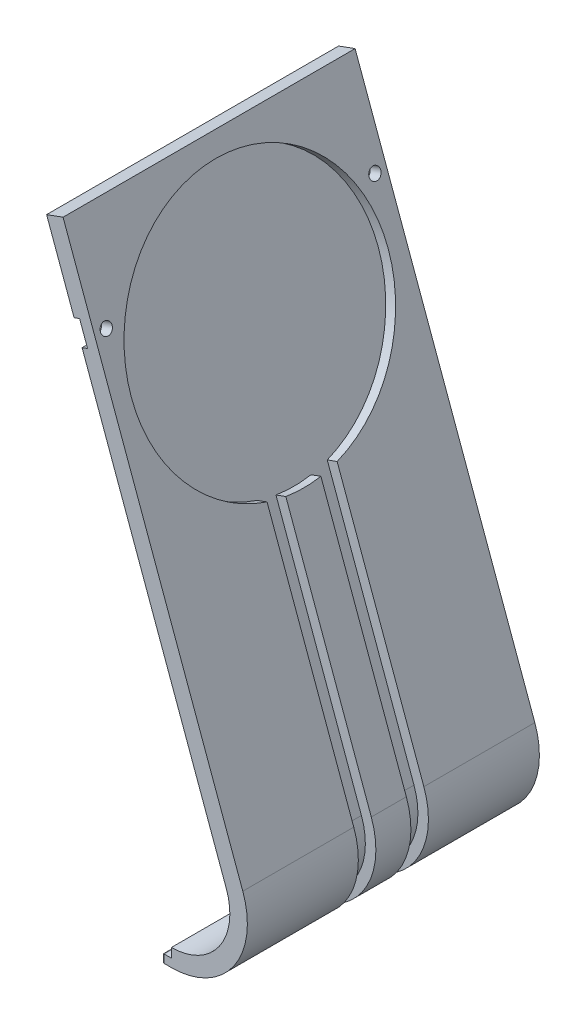
from build123d import *

# Parameters (mm, degrees)
EXTRUDE_1_DEPTH        = 25
SKETCH_4_R             = 22
CUT_EXTRUDE_1_DEPTH    = 1.8
CUT_EXTRUDE_START      = 6
CUT_EXTRUDE_1_2_DEPTH  = 3
SKETCH_11_W            = 18.9
SKETCH_11_H            = 1.4
EXTRUDE_3_DEPTH        = 1.5
FILLET_1_R             = 0.25
SKETCH_12_R            = 1
CUT_EXTRUDE_2553_DEPTH = 99.437390504
CUT_EXTRUDE_1_3_DEPTH  = 1


with BuildPart() as part:
    # 草图2 → 整体拉伸-薄壁1 (new, symmetric)
    with BuildSketch(Plane.XY):
        with BuildLine():
            ThreePointArc((28.874192719, 5.049687275), (37.065713162, 9.313922912), (38.271118927, 18.469888708))
            Line((38.271118927, 18.469888708), (7.496652644, 103.022039918))
            Line((7.496652644, 103.022039918), (10.315730506, 104.048100348))
            Line((10.315730506, 104.048100348), (41.090196789, 19.495949138))
            ThreePointArc((41.090196789, 19.495949138), (39.523169295, 7.593193603), (28.874192719, 2.049687275))
            Line((28.874192719, 2.049687275), (28.874192719, 5.049687275))
        make_face()
    extrude(amount=EXTRUDE_1_DEPTH, both=True)

    # 草图4 → Cut-Extrude 1 (cut)
    with BuildSketch(Plane(origin=(42.549434126, 15.486727507, 0), x_dir=(0, 0, -1), z_dir=(0.9396926207859071, 0.3420201433256726, 0))):
        with Locations((0, 68.845044478)):
            Circle(SKETCH_4_R)
    extrude(amount=-CUT_EXTRUDE_1_DEPTH, mode=Mode.SUBTRACT)

    # 草图3 → Cut-Extrude 1 2 (cut)
    with BuildSketch(Plane.XY.offset(CUT_EXTRUDE_START)):
        with BuildLine():
            ThreePointArc((28.874192719, 3.849687275), (38.048695615, 8.625631188), (39.398750072, 18.88031288))
            Line((39.398750072, 18.88031288), (24.836038582, 58.891033865))
            Line((24.836038582, 58.891033865), (23.809978152, 61.710111727))
            Line((23.809978152, 61.710111727), (25.50142487, 62.325747985))
            Line((25.50142487, 62.325747985), (26.5274853, 59.506670123))
            Line((26.5274853, 59.506670123), (41.090196789, 19.495949138))
            ThreePointArc((41.090196789, 19.495949138), (39.523169295, 7.593193603), (28.874192719, 2.049687275))
            Line((28.874192719, 2.049687275), (28.874192719, 3.849687275))
        make_face()
    cut_extrude_1_2 = extrude(amount=-CUT_EXTRUDE_1_2_DEPTH, mode=Mode.SUBTRACT)

    # 镜向1: Cut-Extrude 1 2 across plane
    add(cut_extrude_1_2.mirror(Plane.XY), mode=Mode.SUBTRACT)

    # 草图11 → 底部卡扣凸台-拉伸3 (add)
    with BuildSketch(Plane.ZY.offset(-28.874192719)):
        with Locations((-15.55, 2.749687275)):
            Rectangle(SKETCH_11_W, SKETCH_11_H)
        with Locations((15.55, 2.749687275)):
            Rectangle(SKETCH_11_W, SKETCH_11_H)
    extrude(amount=EXTRUDE_3_DEPTH)

    # 底部卡扣圆角1
    fillet_1_edges = [part.edges().sort_by_distance(p)[0] for p in [
        (27.374192719, 3.449687275, 15.55),
        (27.374192719, 2.749687275, 25),
        (27.374192719, 2.049687275, 15.55),
        (27.374192719, 2.749687275, 6.1),
        (27.374192719, 3.449687275, -15.55),
        (27.374192719, 2.749687275, -6.1),
        (27.374192719, 2.049687275, -15.55),
        (27.374192719, 2.749687275, -25),
    ]]
    fillet(fillet_1_edges, radius=FILLET_1_R)

    # 草图12 → Cut-Extrude 2553 (cut, through all)
    with BuildSketch(Plane(origin=(39.730356264, 14.460667077, 0), x_dir=(0, 0, 1), z_dir=(-0.9396926207859071, -0.3420201433256726, 0))):
        with Locations((23, 78.482840932)):
            Circle(SKETCH_12_R)
        with Locations((-23, 78.482840932)):
            Circle(SKETCH_12_R)
    extrude(amount=-CUT_EXTRUDE_2553_DEPTH, mode=Mode.SUBTRACT)

    # 草图13 → Cut-Extrude 1 3 (cut)
    with BuildSketch(Plane(origin=(39.730356264, 14.460667077, 0), x_dir=(0, 0, 1), z_dir=(-0.9396926207859071, -0.3420201433256726, 0))):
        with BuildLine():
            Line((23, 80.482840932), (25, 80.482840932))
            Line((25, 80.482840932), (25, 76.482840932))
            Line((25, 76.482840932), (23, 76.482840932))
            ThreePointArc((23, 76.482840932), (21, 78.482840932), (23, 80.482840932))
        make_face()
        with BuildLine():
            Line((-25, 80.482840932), (-25, 76.482840932))
            Line((-25, 76.482840932), (-23, 76.482840932))
            ThreePointArc((-23, 76.482840932), (-21, 78.482840932), (-23, 80.482840932))
            Line((-23, 80.482840932), (-25, 80.482840932))
        make_face()
    extrude(amount=-CUT_EXTRUDE_1_3_DEPTH, mode=Mode.SUBTRACT)


solid = part.part
